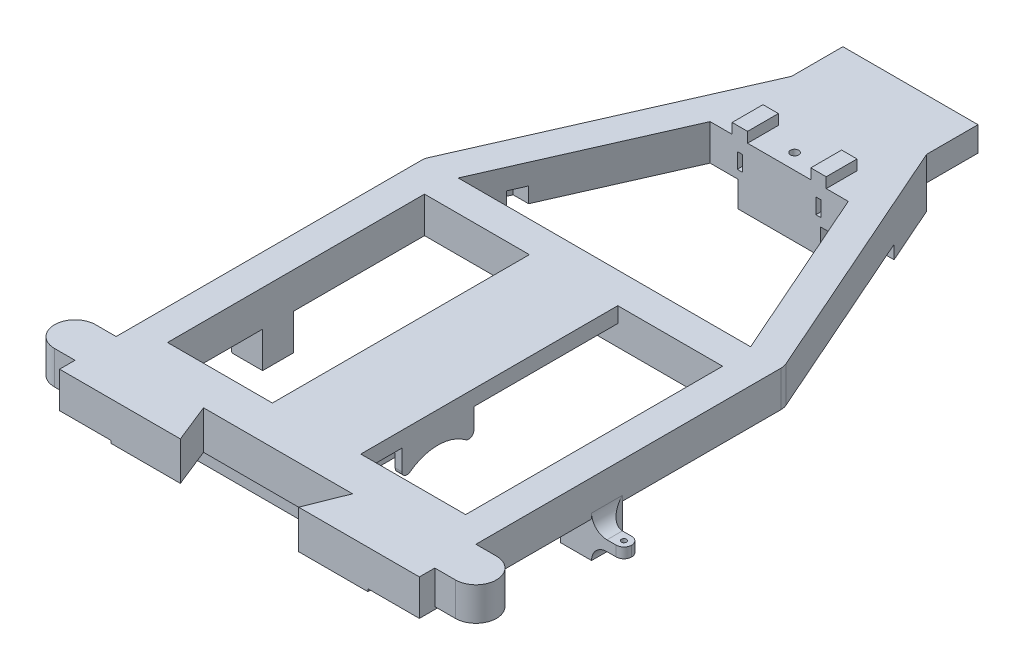
from build123d import *

# Parameters (mm, degrees)
SKETCH1_W             = 58
SKETCH1_H             = 65
BOSS_EXTRUDE1_DEPTH   = 30
BOSS_EXTRUDE3_REACH   = 92.09
SKETCH10_W            = 5
SKETCH10_H            = 14
CUT_EXTRUDE1_REACH    = 111.372
SKETCH2_R             = 2.45
SKETCH2_R_2           = 2.55
CUT_EXTRUDE2_REACH    = 91.744
SKETCH3_W             = 12
SKETCH3_H             = 10
SKETCH11_W            = 3
SKETCH11_H            = 2
BOSS_EXTRUDE4_DEPTH   = 6.3
FILLET3_R             = 1.5
SKETCH12_R            = 0.5
CUT_EXTRUDE3_DEPTH    = 92.15338732
FILLET3_OF_MIRROR1_R  = 1.5
BOSS_EXTRUDE5_REACH   = 111.564
SKETCH13_W            = 15
SKETCH13_H            = 6
BOSS_EXTRUDE6_REACH   = 111.564
SKETCH17_W            = 15
SKETCH17_H            = 14
CUT_EXTRUDE18_REACH   = 129.651
SKETCH35_W            = 16
SKETCH35_H            = 6
FILLET5_R             = 3
BOSS_EXTRUDE7_START   = 20
BOSS_EXTRUDE7_DEPTH   = 10
BOSS_EXTRUDE8_DEPTH   = 20
CUT_EXTRUDE15_REACH   = 95.637
SKETCH28_R            = 0.8
FILLET4_R             = 3
CUT_EXTRUDE16_REACH   = 96.767
SKETCH29_R            = 1.6
SKETCH30_W            = 14
SKETCH30_H            = 1.5
BOSS_EXTRUDE9_DEPTH   = 6.1
SKETCH31_W            = 1.3
SKETCH31_H            = 14
BOSS_EXTRUDE10_DEPTH  = 5
CUT_EXTRUDE17_REACH   = 99.736
FILLET11_R            = 1
FILLET11_OF_MIRROR4_R = 1
MIRROR5_START         = 2.5
MIRROR5_OUTLINE_W     = 1.5
MIRROR5_OUTLINE_H     = 14
MIRROR5_DEPTH         = 6.1
MIRROR5_START_2       = 7.3
MIRROR5_2_DEPTH       = 1.3
SKETCH36_W            = 22
SKETCH36_H            = 15
BOSS_EXTRUDE12_DEPTH  = 14
CUT_EXTRUDE19_DEPTH   = 3
CUT_EXTRUDE20_DEPTH   = 11
CUT_EXTRUDE21_REACH   = 100.983
SKETCH41_W            = 3
SKETCH41_H            = 35
BOSS_EXTRUDE13_DEPTH  = 2
BOSS_EXTRUDE14_START  = -1.789079
SKETCH43_W            = 36.284482562
SKETCH43_H            = 9.6
BOSS_EXTRUDE14_DEPTH  = 66.789079
BOSS_EXTRUDE15_REACH  = 152.996
SKETCH44_W            = 2.842240903
SKETCH44_H            = 50
FILLET6_R             = 8
FILLET7_R             = 5
SKETCH45_W            = 17
SKETCH45_H            = 8
CUT_EXTRUDE22_DEPTH   = 166.644015889
BOSS_EXTRUDE16_REACH  = 152.29
SKETCH46_W            = 4.5
SKETCH46_H            = 5
BOSS_EXTRUDE17_START  = -30
BOSS_EXTRUDE17_DEPTH  = 30
SKETCH49_W            = 8
SKETCH49_H            = 9
CUT_EXTRUDE23_DEPTH   = 8
SKETCH50_R            = 2.45
CUT_EXTRUDE24_DEPTH   = 4.5
CUT_EXTRUDE25_START   = 13.5
SKETCH51_R            = 2.45
CUT_EXTRUDE25_DEPTH   = 4.5
BOSS_EXTRUDE18_REACH  = 165.708
SKETCH53_W            = 5
SKETCH53_H            = 10
SKETCH55_W            = 58
SKETCH55_H            = 10
BOSS_EXTRUDE20_DEPTH  = 4
CUT_EXTRUDE9_START    = -10
SKETCH19_W            = 30
SKETCH19_H            = 15
CUT_EXTRUDE9_DEPTH    = 10
SKETCH58_W            = 70
SKETCH58_H            = 9
CUT_EXTRUDE27_DEPTH   = 153.77843439
BOSS_EXTRUDE22_REACH  = 153.411
SKETCH59_W            = 30
SKETCH59_H            = 5
CUT_EXTRUDE28_REACH   = 183.113
SKETCH18_R            = 1.5
FILLET9_R             = 2
FILLET10_R            = 1
SKETCH60_W            = 70
SKETCH60_H            = 3
BOSS_EXTRUDE23_DEPTH  = 30
CUT_EXTRUDE29_DEPTH   = 7.5
CUT_EXTRUDE30_DEPTH   = 3
SKETCH64_W            = 58
SKETCH64_H            = 4
BOSS_EXTRUDE24_DEPTH  = 6
CUT_EXTRUDE31_DEPTH   = 7.5
CUT_EXTRUDE32_DEPTH   = 153.77843439
SKETCH66_W            = 26.284482562
SKETCH66_H            = 4.8
BOSS_EXTRUDE25_DEPTH  = 10
SKETCH73_W            = 121.646596119
SKETCH73_H            = 145.231140265
CUT_EXTRUDE33_DEPTH   = 16
CUT_EXTRUDE34_DEPTH   = 4
CUT_EXTRUDE35_DEPTH   = 6.5
CUT_EXTRUDE36_DEPTH   = 7
SKETCH79_W            = 43.755200993
SKETCH79_H            = 6.87148653
CUT_EXTRUDE37_DEPTH   = 2
CUT_EXTRUDE38_DEPTH   = 2.4
CUT_EXTRUDE39_DEPTH   = 108.729642392
CUT_EXTRUDE40_DEPTH   = 3
SKETCH83_W            = 1
SKETCH83_H            = 3
CUT_EXTRUDE41_DEPTH   = 2
SKETCH84_W            = 1.8
SKETCH84_H            = 4
CUT_EXTRUDE42_DEPTH   = 2


# Read off the part's stored shape, not the designer's step: Mirror5
# Some blends are built 0.0001 mm under size
with BuildPart() as part:
    # Sketch1 → Boss-Extrude1 (new body)
    with BuildSketch(Plane(origin=(0, 0, 0), x_dir=(1, 0, 0), z_dir=(0, 1, 0))):
        Polygon((-35, 38.5), (-17.352941176, 78.5), (17.352941947, 78.5), (35, 38.5), (35, -38.5), (-35, -38.5), align=None)
        Rectangle(SKETCH1_W, SKETCH1_H, mode=Mode.SUBTRACT)
        Polygon((-28.44203382, 38.5), (28.442033867, 38.5), (13.442034522, 72.5), (-13.44203382, 72.5), align=None, mode=Mode.SUBTRACT)
    extrude(amount=BOSS_EXTRUDE1_DEPTH)

    # Sketch7 → Loft3 section 0
    with BuildSketch(Plane.XY.offset(-32.5)):
        with BuildLine():
            Line((-8.6, 30), (8.6, 30))
            Line((8.6, 30), (8.6, 27))
            Line((8.6, 27), (-8.6, 27))
            Line((-8.6, 27), (-8.6, 30))
        make_face()
    # Sketch8 → Loft3 section 1
    with BuildSketch(Plane.XY.offset(38.5)):
        with BuildLine():
            Line((-8.6, 30), (8.6, 30))
            Line((8.6, 30), (8.6, 27))
            Line((8.6, 27), (-8.6, 27))
            Line((-8.6, 27), (-8.6, 30))
        make_face()
    loft3 = loft()

    # Mirror3: Loft3 across plane
    add(loft3.mirror(Plane(origin=(0, 15, 0), x_dir=(0, 0, 1), z_dir=(0, -1, 0))))

    # Sketch10 → Boss-Extrude3 (add, up to next)
    with BuildSketch(Plane.XZ.offset(-27), mode=Mode.PRIVATE) as boss_extrude3_sk1:
        with Locations((0, 2.5)):
            Rectangle(SKETCH10_W, SKETCH10_H)
    boss_extrude3_tool1 = extrude(boss_extrude3_sk1.sketch, amount=BOSS_EXTRUDE3_REACH, mode=Mode.PRIVATE) - part.part
    add(boss_extrude3_tool1.solids().sort_by_distance((0, 27, 2.5))[0])

    # Sketch2 → Cut-Extrude1 (cut, up to next)
    with BuildSketch(Plane(origin=(35, 0, 0), x_dir=(0, 0, -1), z_dir=(1, 0, 0)), mode=Mode.PRIVATE) as cut_extrude1_sk1:
        with Locations((-2.5, 15)):
            Circle(SKETCH2_R)
    cut_extrude1_tool1 = extrude(cut_extrude1_sk1.sketch, amount=-CUT_EXTRUDE1_REACH, mode=Mode.PRIVATE) & part.part
    # Sketch2 → Cut-Extrude1 (cut, up to next)
    with BuildSketch(Plane(origin=(35, 0, 0), x_dir=(0, 0, -1), z_dir=(1, 0, 0)), mode=Mode.PRIVATE) as cut_extrude1_sk2:
        with Locations((19.5, 15)):
            Circle(SKETCH2_R_2)
    cut_extrude1_tool2 = extrude(cut_extrude1_sk2.sketch, amount=-CUT_EXTRUDE1_REACH, mode=Mode.PRIVATE) & part.part
    cut_extrude1_1 = cut_extrude1_tool1.solids().sort_by_distance((35, 15, 2.5))[0]
    add(cut_extrude1_1, mode=Mode.SUBTRACT)
    cut_extrude1_2 = cut_extrude1_tool2.solids().sort_by_distance((35, 15, -19.5))[0]
    add(cut_extrude1_2, mode=Mode.SUBTRACT)
    cut_extrude1 = cut_extrude1_1 + cut_extrude1_2  # Cut-Extrude1 as one shape, for the pattern or mirror that repeats it

    # Sketch3 → Cut-Extrude2 (cut, up to next)
    with BuildSketch(Plane(origin=(0, 0, -38.5), x_dir=(-1, 0, 0), z_dir=(0, 0, -1)), mode=Mode.PRIVATE) as cut_extrude2_sk1:
        with Locations((0, 15)):
            Rectangle(SKETCH3_W, SKETCH3_H)
    cut_extrude2_tool1 = extrude(cut_extrude2_sk1.sketch, amount=-CUT_EXTRUDE2_REACH, mode=Mode.PRIVATE) & part.part
    add(cut_extrude2_tool1.solids().sort_by_distance((0, 15, -38.5))[0], mode=Mode.SUBTRACT)

    # Sketch11 → Boss-Extrude4 (add)
    with BuildSketch(Plane(origin=(35, 0, 0), x_dir=(0, 0, -1), z_dir=(1, 0, 0))):
        with Locations((2.5, 20)):
            Rectangle(SKETCH11_W, SKETCH11_H)
        with Locations((2.5, 10)):
            Rectangle(SKETCH11_W, SKETCH11_H)
    boss_extrude4 = extrude(amount=BOSS_EXTRUDE4_DEPTH)

    # Fillet3
    fillet3_edges = [part.edges().sort_by_distance(p)[0] for p in [
        (41.3, 10, -1),
        (41.3, 10, -4),
        (41.3, 20, -1),
        (41.3, 20, -4),
    ]]
    fillet(fillet3_edges, radius=FILLET3_R - 0.0001)  # a hair under: the kernel refuses the full size

    # Sketch12 → Cut-Extrude3 (cut, through all)
    with BuildSketch(Plane(origin=(0, 21, 0), x_dir=(1, 0, 0), z_dir=(0, 1, 0))):
        with Locations(Location((39.8, 2.5, 0), (0, 0, 270))):
            Circle(SKETCH12_R)
    cut_extrude3 = extrude(amount=-CUT_EXTRUDE3_DEPTH, mode=Mode.SUBTRACT)

    # Mirror1: Cut-Extrude1, Boss-Extrude4, Cut-Extrude3 across plane
    add(cut_extrude1.mirror(Plane(origin=(0, 0, 0), x_dir=(0, 0, 1), z_dir=(1, 0, 0))), mode=Mode.SUBTRACT)
    add(boss_extrude4.mirror(Plane(origin=(0, 0, 0), x_dir=(0, 0, 1), z_dir=(1, 0, 0))))
    add(cut_extrude3.mirror(Plane(origin=(0, 0, 0), x_dir=(0, 0, 1), z_dir=(1, 0, 0))), mode=Mode.SUBTRACT)

    # Fillet3 of Mirror1
    fillet3_of_mirror1_edges = [part.edges().sort_by_distance(p)[0] for p in [
        (-41.3, 10, -1),
        (-41.3, 10, -4),
        (-41.3, 20, -1),
        (-41.3, 20, -4),
    ]]
    fillet(fillet3_of_mirror1_edges, radius=FILLET3_OF_MIRROR1_R - 0.0001)  # a hair under: the kernel refuses the full size

    # Sketch13 → Boss-Extrude5 (add, up to next)
    with BuildSketch(Plane(origin=(-29, 0, 0), x_dir=(0, 0, -1), z_dir=(1, 0, 0)), mode=Mode.PRIVATE) as boss_extrude5_sk1:
        with Locations((-25, 27)):
            Rectangle(SKETCH13_W, SKETCH13_H)
    boss_extrude5_tool1 = extrude(boss_extrude5_sk1.sketch, amount=BOSS_EXTRUDE5_REACH, mode=Mode.PRIVATE) - part.part
    add(boss_extrude5_tool1.solids().sort_by_distance((-29, 27, 25))[0])

    # Sketch17 → Boss-Extrude6 (add, up to next)
    with BuildSketch(Plane(origin=(-29, 0, 0), x_dir=(0, 0, -1), z_dir=(1, 0, 0)), mode=Mode.PRIVATE) as boss_extrude6_sk1:
        with Locations((-25, 7)):
            Rectangle(SKETCH17_W, SKETCH17_H)
    boss_extrude6_tool1 = extrude(boss_extrude6_sk1.sketch, amount=BOSS_EXTRUDE6_REACH, mode=Mode.PRIVATE) - part.part
    add(boss_extrude6_tool1.solids().sort_by_distance((-29, 7, 25))[0])

    # Sketch35 → Cut-Extrude18 (cut, up to next)
    with BuildSketch(Plane(origin=(0, 0, -78.5), x_dir=(-1, 0, 0), z_dir=(0, 0, -1)), mode=Mode.PRIVATE) as cut_extrude18_sk1:
        with Locations((0, 15)):
            Rectangle(SKETCH35_W, SKETCH35_H)
    cut_extrude18_tool1 = extrude(cut_extrude18_sk1.sketch, amount=-CUT_EXTRUDE18_REACH, mode=Mode.PRIVATE) & part.part
    add(cut_extrude18_tool1.solids().sort_by_distance((0, 15, -78.5))[0], mode=Mode.SUBTRACT)

    # Fillet5
    fillet5_edges = [part.edges().sort_by_distance(p)[0] for p in [
        (-35, 15, -38.5),
        (-17.352941176, 15, -78.5),
        (17.352941947, 15, -78.5),
        (35, 15, -38.5),
        (-8, 15, -78.5),
        (8, 15, -78.5),
    ]]
    fillet(fillet5_edges, radius=FILLET5_R)

    # Sketch24 → Boss-Extrude7 (add)
    with BuildSketch(Plane(origin=(0, 0, 0), x_dir=(1, 0, 0), z_dir=(0, 1, 0)).offset(BOSS_EXTRUDE7_START)):
        Polygon((9.15, 49.5), (9.15, 72.5), (6.15, 72.5), (6.15, 49.5), (-6.15, 49.5), (-6.15, 72.5), (-9.15, 72.5), (-9.15, 49.5), (-23.589092644, 49.5), (-26.23615161, 43.5), (26.23615161, 43.5), (23.589092902, 49.5), align=None)
    extrude(amount=BOSS_EXTRUDE7_DEPTH)

    # Sketch26 → Boss-Extrude8 (add)
    with BuildSketch(Plane(origin=(0, 0, -38.5), x_dir=(-1, 0, 0), z_dir=(0, 0, -1))):
        Polygon((-11, 5), (-11, 0), (11, 0), (11, 5), (11, 15), (6, 15), (6, 10), (-6, 10), (-6, 15), (-11, 15), align=None)
    extrude(amount=BOSS_EXTRUDE8_DEPTH)

    # Sketch28 → Cut-Extrude15 (cut, up to next)
    with BuildSketch(Plane(origin=(0, 30, 0), x_dir=(-1, 0, 0), z_dir=(0, 1, 0)), mode=Mode.PRIVATE) as cut_extrude15_sk1:
        with Locations(Location((0, -46.5, 0), (0, 0, 90))):
            Circle(SKETCH28_R)
    cut_extrude15_tool1 = extrude(cut_extrude15_sk1.sketch, amount=-CUT_EXTRUDE15_REACH, mode=Mode.PRIVATE) & part.part
    # Sketch28 → Cut-Extrude15 (cut, up to next)
    with BuildSketch(Plane(origin=(0, 30, 0), x_dir=(-1, 0, 0), z_dir=(0, 1, 0)), mode=Mode.PRIVATE) as cut_extrude15_sk2:
        with Locations(Location((0, -75.5, 0), (0, 0, 90))):
            Circle(SKETCH28_R)
    cut_extrude15_tool2 = extrude(cut_extrude15_sk2.sketch, amount=-CUT_EXTRUDE15_REACH, mode=Mode.PRIVATE) & part.part
    add(cut_extrude15_tool1.solids().sort_by_distance((0, 30, -46.5))[0], mode=Mode.SUBTRACT)
    add(cut_extrude15_tool2.solids().sort_by_distance((0, 30, -75.5))[0], mode=Mode.SUBTRACT)

    # Fillet4
    fillet4_edges = [part.edges().sort_by_distance(p)[0] for p in [
        (35, 19, -2.5),
        (35, 20, -4),
        (35, 21, -2.5),
        (35, 11, -2.5),
        (35, 9, -2.5),
        (35, 10, -4),
        (-35, 19, -2.5),
        (-35, 20, -4),
        (-35, 21, -2.5),
        (-35, 11, -2.5),
        (-35, 9, -2.5),
        (-35, 10, -4),
    ]]
    fillet(fillet4_edges, radius=FILLET4_R)

    # Sketch29 → Cut-Extrude16 (cut, up to next)
    with BuildSketch(Plane(origin=(2.5, 0, 0), x_dir=(0, 0, -1), z_dir=(1, 0, 0)), mode=Mode.PRIVATE) as cut_extrude16_sk1:
        with Locations(Location((-2.5, 15, 0), (0, 0, 90))):
            Circle(SKETCH29_R)
    cut_extrude16_tool1 = extrude(cut_extrude16_sk1.sketch, amount=-CUT_EXTRUDE16_REACH, mode=Mode.PRIVATE) & part.part
    add(cut_extrude16_tool1.solids().sort_by_distance((2.5, 15, 2.5))[0], mode=Mode.SUBTRACT)

    # Sketch30 → Boss-Extrude9 (add)
    with BuildSketch(Plane.ZY.offset(2.5)):
        with Locations((2.5, 26.25)):
            Rectangle(SKETCH30_W, SKETCH30_H)
    boss_extrude9 = extrude(amount=BOSS_EXTRUDE9_DEPTH)

    # Sketch31 → Boss-Extrude10 (add)
    with BuildSketch(Plane.XZ.offset(-25.5)):
        with Locations((-7.95, 2.5)):
            Rectangle(SKETCH31_W, SKETCH31_H)
    boss_extrude10 = extrude(amount=BOSS_EXTRUDE10_DEPTH)

    # Sketch32 → Cut-Extrude17 (cut, up to next)
    with BuildSketch(Plane.ZY.offset(8.6), mode=Mode.PRIVATE) as cut_extrude17_sk1:
        with BuildLine():
            Line((-4.5, 20.5), (-4.5, 20.656854249))
            ThreePointArc((-4.5, 20.656854249), (2.5, 24), (9.5, 20.656854249))
            Line((9.5, 20.656854249), (9.5, 20.5))
            Line((9.5, 20.5), (-4.5, 20.5))
        make_face()
    cut_extrude17_tool1 = extrude(cut_extrude17_sk1.sketch, amount=-CUT_EXTRUDE17_REACH, mode=Mode.PRIVATE) & part.part
    cut_extrude17 = cut_extrude17_tool1.solids().sort_by_distance((-8.6, 21.927092, 2.5))[0]
    add(cut_extrude17, mode=Mode.SUBTRACT)

    # Fillet11
    fillet11_edges = [part.edges().sort_by_distance(p)[0] for p in [
        (-7.95, 20.656854249, 9.5),
        (-7.95, 20.656854249, -4.5),
    ]]
    fillet(fillet11_edges, radius=FILLET11_R)

    # Mirror4: Boss-Extrude9, Boss-Extrude10, Cut-Extrude17 across plane
    add(boss_extrude9.mirror(Plane(origin=(0, 15, 0), x_dir=(0, 0, 1), z_dir=(0, -1, 0))))
    add(boss_extrude10.mirror(Plane(origin=(0, 15, 0), x_dir=(0, 0, 1), z_dir=(0, -1, 0))))
    add(cut_extrude17.mirror(Plane(origin=(0, 15, 0), x_dir=(0, 0, 1), z_dir=(0, -1, 0))), mode=Mode.SUBTRACT)

    # Fillet11 of Mirror4
    fillet11_of_mirror4_edges = [part.edges().sort_by_distance(p)[0] for p in [
        (-7.95, 9.343145751, 9.5),
        (-7.95, 9.343145751, -4.5),
    ]]
    fillet(fillet11_of_mirror4_edges, radius=FILLET11_OF_MIRROR4_R)

    # Mirror5 outline → Mirror5 (add)
    with BuildSketch(Plane.YZ.offset(MIRROR5_START)):
        with Locations((3.75, 2.5)):
            Rectangle(MIRROR5_OUTLINE_W, MIRROR5_OUTLINE_H)
        with Locations((26.25, 2.5)):
            Rectangle(MIRROR5_OUTLINE_W, MIRROR5_OUTLINE_H)
    extrude(amount=MIRROR5_DEPTH)

    # Mirror5 2 outline → Mirror5 2 (add)
    with BuildSketch(Plane.YZ.offset(MIRROR5_START_2)):
        with BuildLine():
            Line((7, 9.5), (4.5, 9.5))
            Line((4.5, 9.5), (4.5, -4.5))
            Line((4.5, -4.5), (7, -4.5))
            ThreePointArc((7, -4.5), (7.894427191, -3.947213595), (7.8, -2.9))
            ThreePointArc((7.8, -2.9), (6, 2.5), (7.8, 7.9))
            ThreePointArc((7.8, 7.9), (7.894427191, 8.947213595), (7, 9.5))
        make_face()
        with BuildLine():
            Line((25.5, 9.5), (23, 9.5))
            ThreePointArc((23, 9.5), (22.105572809, 8.947213595), (22.2, 7.9))
            ThreePointArc((22.2, 7.9), (24, 2.5), (22.2, -2.9))
            ThreePointArc((22.2, -2.9), (22.105572809, -3.947213595), (23, -4.5))
            Line((23, -4.5), (25.5, -4.5))
            Line((25.5, -4.5), (25.5, 9.5))
        make_face()
    extrude(amount=MIRROR5_2_DEPTH)

    # Sketch36 → Boss-Extrude12 (add)
    with BuildSketch(Plane(origin=(0, 0, -58.5), x_dir=(-1, 0, 0), z_dir=(0, 0, -1))):
        with Locations((0, 7.5)):
            Rectangle(SKETCH36_W, SKETCH36_H)
    extrude(amount=BOSS_EXTRUDE12_DEPTH)

    # Sketch37 → Cut-Extrude19 (cut)
    with BuildSketch(Plane.XY.offset(-58.5)):
        with BuildLine():
            Line((-6, 15), (6, 15))
            ThreePointArc((6, 15), (5.340169944, 12.204915028), (3.5, 10))
            Line((3.5, 10), (-3.5, 10))
            ThreePointArc((-3.5, 10), (-5.340169944, 12.204915028), (-6, 15))
        make_face()
    extrude(amount=-CUT_EXTRUDE19_DEPTH, mode=Mode.SUBTRACT)

    # Sketch38 → Cut-Extrude20 (cut)
    with BuildSketch(Plane.XY.offset(-61.5)):
        with BuildLine():
            Line((-6, 15), (6, 15))
            ThreePointArc((6, 15), (0, 12), (-6, 15))
        make_face()
    extrude(amount=-CUT_EXTRUDE20_DEPTH, mode=Mode.SUBTRACT)

    # Cut-Extrude21: up to this face of the body (flat: up to its plane)
    cut_extrude21_end = Plane(part.part.faces().sort_by_distance((11, 7.5, -55.5))[0])
    # Sketch40 → Cut-Extrude21 (cut, up to the picked face)
    with BuildSketch(Plane.ZY.offset(11), mode=Mode.PRIVATE) as cut_extrude21_sk1:
        Polygon((-58.5, 15), (-72.5, 15), (-72.5, 12), align=None)
    cut_extrude21_tool1 = split(extrude(cut_extrude21_sk1.sketch, amount=-CUT_EXTRUDE21_REACH, mode=Mode.PRIVATE), bisect_by=cut_extrude21_end, keep=Keep.BOTH, mode=Mode.PRIVATE)
    add(cut_extrude21_tool1.solids().sort_by(Axis((-11, 14, -67.833333), (1, 0, 0)))[0], mode=Mode.SUBTRACT)

    # Sketch41 → Boss-Extrude13 (add)
    with BuildSketch(Plane(origin=(0, 30, 0), x_dir=(1, 0, 0), z_dir=(0, 1, 0))):
        with Locations((-7.65, 61)):
            Rectangle(SKETCH41_W, SKETCH41_H)
        with Locations((7.65, 61)):
            Rectangle(SKETCH41_W, SKETCH41_H)
    extrude(amount=BOSS_EXTRUDE13_DEPTH)

    # Sketch43 → Boss-Extrude14 (add)
    with BuildSketch(Plane(origin=(0, 0, -78.5), x_dir=(-1, 0, 0), z_dir=(0, 0, -1)).offset(BOSS_EXTRUDE14_START)):
        with Locations((-3.78e-07, 4.8)):
            Rectangle(SKETCH43_W, SKETCH43_H)
        with Locations((-3.78e-07, 25.2)):
            Rectangle(SKETCH43_W, SKETCH43_H)
    extrude(amount=BOSS_EXTRUDE14_DEPTH)

    # Sketch44 → Boss-Extrude15 (add, up to next)
    with BuildSketch(Plane(origin=(0, 9.6, 0), x_dir=(1, 0, 0), z_dir=(0, 1, 0)), mode=Mode.PRIVATE) as boss_extrude15_sk1:
        with Locations((-16.721120451, 118.5)):
            Rectangle(SKETCH44_W, SKETCH44_H)
    boss_extrude15_tool1 = extrude(boss_extrude15_sk1.sketch, amount=BOSS_EXTRUDE15_REACH, mode=Mode.PRIVATE) - part.part
    # Sketch44 → Boss-Extrude15 (add, up to next)
    with BuildSketch(Plane(origin=(0, 9.6, 0), x_dir=(1, 0, 0), z_dir=(0, 1, 0)), mode=Mode.PRIVATE) as boss_extrude15_sk2:
        Polygon((18.142241659, 143.5), (15.3, 143.5), (15.3, 93.5), (18.142240903, 93.5), align=None)
    boss_extrude15_tool2 = extrude(boss_extrude15_sk2.sketch, amount=BOSS_EXTRUDE15_REACH, mode=Mode.PRIVATE) - part.part
    add(boss_extrude15_tool1.solids().sort_by_distance((-16.72112, 9.6, -118.5))[0])
    add(boss_extrude15_tool2.solids().sort_by_distance((16.721121, 9.6, -118.500001))[0])

    # Fillet6
    fillet6_edges = [part.edges().sort_by_distance(p)[0] for p in [
        (3.78e-07, 0, -143.5),
        (3.78e-07, 30, -143.5),
    ]]
    fillet(fillet6_edges, radius=FILLET6_R)

    # Fillet7
    # the kernel refuses this fillet: 5 mm, written as the material it takes off along each edge
    with BuildSketch(Plane(origin=(18.142241659, 0, -64.210921), x_dir=(-1, 0, 0), z_dir=(0, 0, -1))) as fillet7_piece_1_section:
        with BuildLine():
            CenterArc((FILLET7_R, FILLET7_R), FILLET7_R, 180, 90)
            Line((0, FILLET7_R), (0, 0))
            Line((0, 0), (FILLET7_R, 0))
        make_face()
    fillet7_piece_1 = extrude(amount=71.289079, mode=Mode.PRIVATE)
    fillet7_piece_1 = split(fillet7_piece_1, bisect_by=Plane(origin=(6.655944686, 1.159648817, -102.746528186), z_dir=(0.9149178080838143, 0, -0.4036401918182936)), keep=Keep.TOP, mode=Mode.PRIVATE)
    with BuildSketch(Plane(origin=(18.142241659, 8, -135.5), x_dir=(0, -1, 0), z_dir=(0, 0, 1))) as fillet7_piece_2:
        with BuildLine():
            CenterArc((8 - FILLET7_R, -FILLET7_R), FILLET7_R, 0, 90)
            Line((8 - FILLET7_R, 0), (8, 0))
            Line((8, 0), (8, -FILLET7_R))
        make_face()
    fillet7_piece_2_solid = revolve(axis=Axis((18.142241659, 8, -135.5), (1, 0, 0)), revolution_arc=90, mode=Mode.PRIVATE)
    with BuildSketch(Plane(origin=(18.142241659, 9.6, -143.5), x_dir=(-1, 0, 0), z_dir=(0, 1, 0))) as fillet7_piece_3:
        with BuildLine():
            CenterArc((FILLET7_R * 1.00000001512, FILLET7_R), FILLET7_R, 179.999999134, 90.000000866)
            Line((FILLET7_R * 1.511713279e-08, FILLET7_R * 1.00000001512), (0, 0))
            Line((0, 0), (FILLET7_R * 1.00000001512, 0))
        make_face()
    fillet7_piece_3_solid = extrude(amount=10.8, mode=Mode.PRIVATE)
    with BuildSketch(Plane(origin=(18.142241659, 22, -135.5), x_dir=(0, 1, 0), z_dir=(0, 0, 1))) as fillet7_piece_4:
        with BuildLine():
            CenterArc((8 - FILLET7_R, FILLET7_R), FILLET7_R, 270, 90)
            Line((8 - FILLET7_R, 0), (8, 0))
            Line((8, 0), (8, FILLET7_R))
        make_face()
    fillet7_piece_4_solid = revolve(axis=Axis((18.142241659, 22, -135.5), (-1, 0, 0)), revolution_arc=90, mode=Mode.PRIVATE)
    with BuildSketch(Plane(origin=(-18.142240903, 0, -64.210921), x_dir=(0, 1, 0), z_dir=(0, 0, -1))) as fillet7_piece_5_section:
        with BuildLine():
            CenterArc((FILLET7_R, FILLET7_R), FILLET7_R, 180, 90)
            Line((0, FILLET7_R), (0, 0))
            Line((0, 0), (FILLET7_R, 0))
        make_face()
    fillet7_piece_5 = extrude(amount=71.289079, mode=Mode.PRIVATE)
    fillet7_piece_5 = split(fillet7_piece_5, bisect_by=Plane(origin=(-6.655943611, 1.159648816, -102.746527816), z_dir=(-0.914917801572932, 0, -0.40364020657629374)), keep=Keep.TOP, mode=Mode.PRIVATE)
    with BuildSketch(Plane(origin=(-18.142240903, 8, -135.5), x_dir=(0, -1, 0), z_dir=(0, 0, 1))) as fillet7_piece_6:
        with BuildLine():
            CenterArc((8 - FILLET7_R, FILLET7_R), FILLET7_R, 270, 90)
            Line((8, FILLET7_R), (8, 0))
            Line((8, 0), (8 - FILLET7_R, 0))
        make_face()
    fillet7_piece_6_solid = revolve(axis=Axis((-18.142240903, 8, -135.5), (1, 0, 0)), revolution_arc=90, mode=Mode.PRIVATE)
    with BuildSketch(Plane(origin=(-18.142240903, 22, -143.5), x_dir=(0, 0, 1), z_dir=(0, -1, 0))) as fillet7_piece_7:
        with BuildLine():
            CenterArc((FILLET7_R, -FILLET7_R), FILLET7_R, 90, 90)
            Line((0, -FILLET7_R), (0, 0))
            Line((0, 0), (FILLET7_R, 0))
        make_face()
    fillet7_piece_7_solid = extrude(amount=14, mode=Mode.PRIVATE)
    with BuildSketch(Plane(origin=(-18.142240903, 22, -135.5), x_dir=(0, 1, 0), z_dir=(0, 0, 1))) as fillet7_piece_8:
        with BuildLine():
            CenterArc((8 - FILLET7_R, -FILLET7_R), FILLET7_R, 0, 90)
            Line((8, -FILLET7_R), (8, 0))
            Line((8, 0), (8 - FILLET7_R, 0))
        make_face()
    fillet7_piece_8_solid = revolve(axis=Axis((-18.142240903, 22, -135.5), (-1, 0, 0)), revolution_arc=90, mode=Mode.PRIVATE)
    with BuildSketch(Plane(origin=(18.142241659, 30, -64.210921), x_dir=(-1, 0, 0), z_dir=(0, 0, -1))) as fillet7_piece_9_section:
        with BuildLine():
            CenterArc((FILLET7_R, -FILLET7_R), FILLET7_R, 90, 90)
            Line((0, -FILLET7_R), (0, 0))
            Line((0, 0), (FILLET7_R, 0))
        make_face()
    fillet7_piece_9 = extrude(amount=71.289079, mode=Mode.PRIVATE)
    fillet7_piece_9 = split(fillet7_piece_9, bisect_by=Plane(origin=(6.655944686, 28.840351183, -102.746528186), z_dir=(0.9149178080838143, 0, -0.4036401918182936)), keep=Keep.TOP, mode=Mode.PRIVATE)
    with BuildSketch(Plane(origin=(-18.142240903, 30, -64.210921), x_dir=(1, 0, 0), z_dir=(0, 0, -1))) as fillet7_piece_10_section:
        with BuildLine():
            CenterArc((FILLET7_R, FILLET7_R), FILLET7_R, 180, 90)
            Line((0, FILLET7_R), (0, 0))
            Line((0, 0), (FILLET7_R, 0))
        make_face()
    fillet7_piece_10 = extrude(amount=71.289079, mode=Mode.PRIVATE)
    fillet7_piece_10 = split(fillet7_piece_10, bisect_by=Plane(origin=(-6.655943611, 28.840351184, -102.746527816), z_dir=(-0.914917801572932, 0, -0.40364020657629374)), keep=Keep.TOP, mode=Mode.PRIVATE)
    with BuildSketch(Plane(origin=(18.142241659, 20.4, -143.5), x_dir=(0, 0, 1), z_dir=(0, 1, 0)), Plane(origin=(18.142241659, 9.6, -143.5), x_dir=(-1, 0, 0), z_dir=(0, -1, 0))) as fillet7_piece_11:
        with BuildLine():
            CenterArc((FILLET7_R, -FILLET7_R), FILLET7_R, 90, 90)
            Line((0, -FILLET7_R), (0, 0))
            Line((0, 0), (FILLET7_R, 0))
        make_face()
    fillet7_piece_11_solid = extrude(amount=1.6, mode=Mode.PRIVATE)
    add([fillet7_piece_1, fillet7_piece_2_solid, fillet7_piece_3_solid, fillet7_piece_4_solid, fillet7_piece_5, fillet7_piece_6_solid, fillet7_piece_7_solid, fillet7_piece_8_solid, fillet7_piece_9, fillet7_piece_10, fillet7_piece_11_solid], mode=Mode.SUBTRACT)

    # Sketch45 → Cut-Extrude22 (cut, through all)
    with BuildSketch(Plane(origin=(35, 0, 0), x_dir=(0, 0, -1), z_dir=(1, 0, 0))):
        with Locations((-24, 19)):
            Rectangle(SKETCH45_W, SKETCH45_H)
    extrude(amount=-CUT_EXTRUDE22_DEPTH, mode=Mode.SUBTRACT)

    # Sketch46 → Boss-Extrude16 (add, up to next)
    with BuildSketch(Plane(origin=(0, 15, 0), x_dir=(1, 0, 0), z_dir=(0, 1, 0)), mode=Mode.PRIVATE) as boss_extrude16_sk1:
        with Locations((31.25, -30)):
            Rectangle(SKETCH46_W, SKETCH46_H)
    boss_extrude16_tool1 = extrude(boss_extrude16_sk1.sketch, amount=BOSS_EXTRUDE16_REACH, mode=Mode.PRIVATE) - part.part
    boss_extrude16 = boss_extrude16_tool1.solids().sort_by_distance((31.25, 15, 30))[0]
    add(boss_extrude16)

    # Sketch48 → Boss-Extrude17 (add)
    with BuildSketch(Plane.XZ.offset(BOSS_EXTRUDE17_START)):
        with BuildLine():
            Line((35, 29.5), (39, 29.5))
            ThreePointArc((39, 29.5), (43, 25.5), (39, 21.5))
            Line((39, 21.5), (35, 21.5))
            Line((35, 21.5), (35, 29.5))
        make_face()
    boss_extrude17 = extrude(amount=BOSS_EXTRUDE17_DEPTH)

    # Sketch49 → Cut-Extrude23 (cut)
    with BuildSketch(Plane.XY.offset(29.5)):
        with Locations((39, 19)):
            Rectangle(SKETCH49_W, SKETCH49_H)
    cut_extrude23 = extrude(amount=-CUT_EXTRUDE23_DEPTH, mode=Mode.SUBTRACT)

    # Sketch50 → Cut-Extrude24 (cut)
    with BuildSketch(Plane(origin=(0, 14.5, 0), x_dir=(1, 0, 0), z_dir=(0, 1, 0))):
        with Locations(Location((39, -25.5, 0), (0, 0, 270))):
            Circle(SKETCH50_R)
    cut_extrude24 = extrude(amount=-CUT_EXTRUDE24_DEPTH, mode=Mode.SUBTRACT)

    # Sketch51 → Cut-Extrude25 (cut)
    with BuildSketch(Plane(origin=(0, 14.5, 0), x_dir=(1, 0, 0), z_dir=(0, 1, 0)).offset(CUT_EXTRUDE25_START)):
        with Locations(Location((39, -25.5, 0), (0, 0, 270))):
            Circle(SKETCH51_R)
    cut_extrude25 = extrude(amount=-CUT_EXTRUDE25_DEPTH, mode=Mode.SUBTRACT)

    # Mirror7: Boss-Extrude16, Boss-Extrude17, Cut-Extrude23, Cut-Extrude24, Cut-Extrude25 across plane
    add(boss_extrude16.mirror(Plane(origin=(0, 0, 0), x_dir=(0, 0, 1), z_dir=(1, 0, 0))))
    add(boss_extrude17.mirror(Plane(origin=(0, 0, 0), x_dir=(0, 0, 1), z_dir=(1, 0, 0))))
    add(cut_extrude23.mirror(Plane(origin=(0, 0, 0), x_dir=(0, 0, 1), z_dir=(1, 0, 0))), mode=Mode.SUBTRACT)
    add(cut_extrude24.mirror(Plane(origin=(0, 0, 0), x_dir=(0, 0, 1), z_dir=(1, 0, 0))), mode=Mode.SUBTRACT)
    add(cut_extrude25.mirror(Plane(origin=(0, 0, 0), x_dir=(0, 0, 1), z_dir=(1, 0, 0))), mode=Mode.SUBTRACT)

    # Sketch53 → Boss-Extrude18 (add, up to next)
    with BuildSketch(Plane.ZY.offset(-29), mode=Mode.PRIVATE) as boss_extrude18_sk1:
        with Locations((30, 19)):
            Rectangle(SKETCH53_W, SKETCH53_H)
    boss_extrude18_tool1 = extrude(boss_extrude18_sk1.sketch, amount=BOSS_EXTRUDE18_REACH, mode=Mode.PRIVATE) - part.part
    add(boss_extrude18_tool1.solids().sort_by_distance((29, 19, 30))[0])

    # Sketch55 → Boss-Extrude20 (add)
    with BuildSketch(Plane(origin=(0, 0, 27.5), x_dir=(-1, 0, 0), z_dir=(0, 0, -1))):
        with Locations((0, 19)):
            Rectangle(SKETCH55_W, SKETCH55_H)
    extrude(amount=BOSS_EXTRUDE20_DEPTH)

    # Sketch19 → Cut-Extrude9 (cut)
    with BuildSketch(Plane(origin=(0, 30, 0), x_dir=(1, 0, 0), z_dir=(0, 1, 0)).offset(CUT_EXTRUDE9_START)):
        with Locations((0, -25)):
            Rectangle(SKETCH19_W, SKETCH19_H)
    extrude(amount=-CUT_EXTRUDE9_DEPTH, mode=Mode.SUBTRACT)

    # Sketch58 → Cut-Extrude27 (cut, through all)
    with BuildSketch(Plane(origin=(0, 30, 0), x_dir=(1, 0, 0), z_dir=(0, 1, 0))):
        with Locations((0, -34)):
            Rectangle(SKETCH58_W, SKETCH58_H)
    extrude(amount=-CUT_EXTRUDE27_DEPTH, mode=Mode.SUBTRACT)

    # Sketch59 → Boss-Extrude22 (add, up to next)
    with BuildSketch(Plane(origin=(0, 10, 0), x_dir=(1, 0, 0), z_dir=(0, 1, 0)), mode=Mode.PRIVATE) as boss_extrude22_sk1:
        with Locations((0, -27)):
            Rectangle(SKETCH59_W, SKETCH59_H)
    boss_extrude22_tool1 = extrude(boss_extrude22_sk1.sketch, amount=BOSS_EXTRUDE22_REACH, mode=Mode.PRIVATE) - part.part
    add(boss_extrude22_tool1.solids().sort_by_distance((0, 10, 27))[0])

    # Sketch18 → Cut-Extrude28 (cut, up to next)
    with BuildSketch(Plane.XY.offset(29.5), mode=Mode.PRIVATE) as cut_extrude28_sk1:
        with Locations((7.5, 15)):
            Circle(SKETCH18_R)
    cut_extrude28_tool1 = extrude(cut_extrude28_sk1.sketch, amount=-CUT_EXTRUDE28_REACH, mode=Mode.PRIVATE) & part.part
    # Sketch18 → Cut-Extrude28 (cut, up to next)
    with BuildSketch(Plane.XY.offset(29.5), mode=Mode.PRIVATE) as cut_extrude28_sk2:
        with Locations((-7.5, 15)):
            Circle(SKETCH18_R)
    cut_extrude28_tool2 = extrude(cut_extrude28_sk2.sketch, amount=-CUT_EXTRUDE28_REACH, mode=Mode.PRIVATE) & part.part
    add(cut_extrude28_tool1.solids().sort_by_distance((7.5, 15, 29.5))[0], mode=Mode.SUBTRACT)
    add(cut_extrude28_tool2.solids().sort_by_distance((-7.5, 15, 29.5))[0], mode=Mode.SUBTRACT)

    # Fillet9
    fillet9_edges = [part.edges().sort_by_distance(p)[0] for p in [
        (6, 15, 24.5),
        (-9, 15, 24.5),
    ]]
    fillet(fillet9_edges, radius=FILLET9_R)

    # Fillet10
    fillet10_edges = [part.edges().sort_by_distance(p)[0] for p in [
        (6, 15, 29.5),
        (-9, 15, 29.5),
    ]]
    fillet(fillet10_edges, radius=FILLET10_R)

    # Sketch60 → Boss-Extrude23 (add)
    with BuildSketch(Plane.XZ):
        with Locations((0, 31)):
            Rectangle(SKETCH60_W, SKETCH60_H)
    extrude(amount=-BOSS_EXTRUDE23_DEPTH)

    # Sketch61 → Cut-Extrude29 (cut)
    with BuildSketch(Plane.XZ):
        Polygon((11.5, 32.5), (-11.5, 32.5), (-14.5, 25), (14.5, 25), align=None)
    extrude(amount=-CUT_EXTRUDE29_DEPTH, mode=Mode.SUBTRACT)

    # Sketch62 → Cut-Extrude30 (cut)
    with BuildSketch(Plane.XY.offset(32.5)):
        with BuildLine():
            Line((-7.5, 17.5), (7.5, 17.5))
            ThreePointArc((7.5, 17.5), (10, 15), (7.5, 12.5))
            Line((7.5, 12.5), (-7.5, 12.5))
            ThreePointArc((-7.5, 12.5), (-10, 15), (-7.5, 17.5))
        make_face()
    extrude(amount=-CUT_EXTRUDE30_DEPTH, mode=Mode.SUBTRACT)

    # Sketch64 → Boss-Extrude24 (add)
    with BuildSketch(Plane(origin=(0, 0, 23.5), x_dir=(-1, 0, 0), z_dir=(0, 0, -1))):
        with Locations((0, 22)):
            Rectangle(SKETCH64_W, SKETCH64_H)
    extrude(amount=BOSS_EXTRUDE24_DEPTH)

    # Sketch63 → Cut-Extrude31 (cut)
    with BuildSketch(Plane(origin=(0, 30, 0), x_dir=(1, 0, 0), z_dir=(0, 1, 0))):
        Polygon((-11.5, -32.5), (11.5, -32.5), (14.5, -25), (-14.5, -25), align=None)
    extrude(amount=-CUT_EXTRUDE31_DEPTH, mode=Mode.SUBTRACT)

    # Sketch65 → Cut-Extrude32 (cut, through all)
    with BuildSketch(Plane(origin=(0, 30, 0), x_dir=(1, 0, 0), z_dir=(0, 1, 0))):
        Polygon((-13.142240903, 88.044253953), (13.142241659, 88.044254404), (18.142241659, 76.710920576), (18.142241659, 143.5), (-18.142240903, 143.5), (-18.142240903, 76.71092062), align=None)
    extrude(amount=-CUT_EXTRUDE32_DEPTH, mode=Mode.SUBTRACT)

    # Sketch66 → Boss-Extrude25 (add)
    with BuildSketch(Plane(origin=(-1.51e-06, 0, -88.044254178), x_dir=(-0.9999999999999999, 0, 1.7148916448299635e-08), z_dir=(-1.7148916448299635e-08, 0, -0.9999999999999999))):
        with Locations((-1.888e-06, 27.6)):
            Rectangle(SKETCH66_W, SKETCH66_H)
        with Locations((-1.888e-06, 2.4)):
            Rectangle(SKETCH66_W, SKETCH66_H)
    extrude(amount=BOSS_EXTRUDE25_DEPTH)

    # Sketch73 → Cut-Extrude33 (cut)
    with BuildSketch(Plane.XZ):
        with Locations((0.620645899, -33.237611814)):
            Rectangle(SKETCH73_W, SKETCH73_H)
    extrude(amount=-CUT_EXTRUDE33_DEPTH, mode=Mode.SUBTRACT)

    # Sketch75 → Cut-Extrude34 (cut)
    with BuildSketch(Plane.XZ.offset(-16)):
        Polygon((-2.5, -7), (8.6, -7), (8.6, 23.5), (29, 23.5), (29, 24.5), (8.6, 24.5), (-8.6, 24.5), (-29, 24.5), (-29, 23.5), (-8.6, 23.5), (-8.6, -7), align=None)
    extrude(amount=-CUT_EXTRUDE34_DEPTH, mode=Mode.SUBTRACT)

    # Sketch76 → Cut-Extrude35 (cut)
    with BuildSketch(Plane.XZ.offset(-16)):
        Polygon((-24.977236043, 32.5), (25, 32.5), (25, 24.5), (13.214480845, 24.5), (-24.977236043, 24.5), align=None)
    extrude(amount=-CUT_EXTRUDE35_DEPTH, mode=Mode.SUBTRACT)

    # Sketch78 → Cut-Extrude36 (cut)
    with BuildSketch(Plane.XZ.offset(-16)):
        Polygon((-24.977236043, 32.5), (-35, 32.5), (-35, -1), (-29, -1), (-29, 17.5), (-29, 24.5), (-24.977236043, 24.5), align=None)
        Polygon((-35, -7), (-29, -7), (-29, -32.5), (29, -32.5), (29, -7), (35, -7), (35, -76.71092062), (18.142240903, -76.71092062), (8, -76.71092062), (8, -72.5), (13.44203382, -72.5), (28.44203382, -38.5), (-28.44203382, -38.5), (-13.44203382, -72.5), (-8, -72.5), (-8, -76.71092062), (-18.142240903, -76.71092062), (-35, -76.71092062), align=None)
        Polygon((35, -1), (29, -1), (29, 24.5), (25, 24.5), (24.977236043, 32.5), (35, 32.5), align=None)
    extrude(amount=-CUT_EXTRUDE36_DEPTH, mode=Mode.SUBTRACT)

    # Sketch79 → Cut-Extrude37 (cut)
    with BuildSketch(Plane.XZ.offset(-16)):
        with Locations((0.386040845, -77.09592916)):
            Rectangle(SKETCH79_W, SKETCH79_H)
    extrude(amount=-CUT_EXTRUDE37_DEPTH, mode=Mode.SUBTRACT)

    # Sketch80 → Cut-Extrude38 (cut)
    with BuildSketch(Plane.XZ.offset(-18)):
        Polygon((-11.000000335, -98.04425399), (-11.000000335, -72.5), (-26.779624803, -72.5), (-26.779624803, -98.044253719), align=None)
        Polygon((26.779624803, -72.5), (11.000000335, -72.5), (11.000000335, -98.04425399), (26.779624803, -98.044253719), align=None)
    extrude(amount=-CUT_EXTRUDE38_DEPTH, mode=Mode.SUBTRACT)

    # Sketch81 → Cut-Extrude39 (cut, through all)
    with BuildSketch(Plane.XZ.offset(-20)):
        Polygon((-26.236151467, -43.5), (26.236151467, -43.5), (13.44203382, -72.5), (-13.44203382, -72.5), align=None)
    extrude(amount=-CUT_EXTRUDE39_DEPTH, mode=Mode.SUBTRACT)

    # Sketch82 → Cut-Extrude40 (cut)
    with BuildSketch(Plane.XZ.offset(-23)):
        Polygon((-25.574386761, -45), (-24.25085735, -48), (-27.25085735, -48), (-28.574386761, -45), align=None)
        Polygon((28.574386761, -45), (27.25085735, -48), (24.25085735, -48), (25.574386761, -45), align=None)
    extrude(amount=-CUT_EXTRUDE40_DEPTH, mode=Mode.SUBTRACT)

    # Sketch83 → Cut-Extrude41 (cut)
    with BuildSketch(Plane.XY.offset(-72.5)):
        with Locations((7.65, 26.1)):
            Rectangle(SKETCH83_W, SKETCH83_H)
        with Locations((-7.65, 26.1)):
            Rectangle(SKETCH83_W, SKETCH83_H)
    extrude(amount=-CUT_EXTRUDE41_DEPTH, mode=Mode.SUBTRACT)

    # Sketch84 → Cut-Extrude42 (cut)
    with BuildSketch(Plane.XZ.offset(-20)):
        with Locations((0, 2.5)):
            Rectangle(SKETCH84_W, SKETCH84_H)
    extrude(amount=-CUT_EXTRUDE42_DEPTH, mode=Mode.SUBTRACT)


solid = part.part
